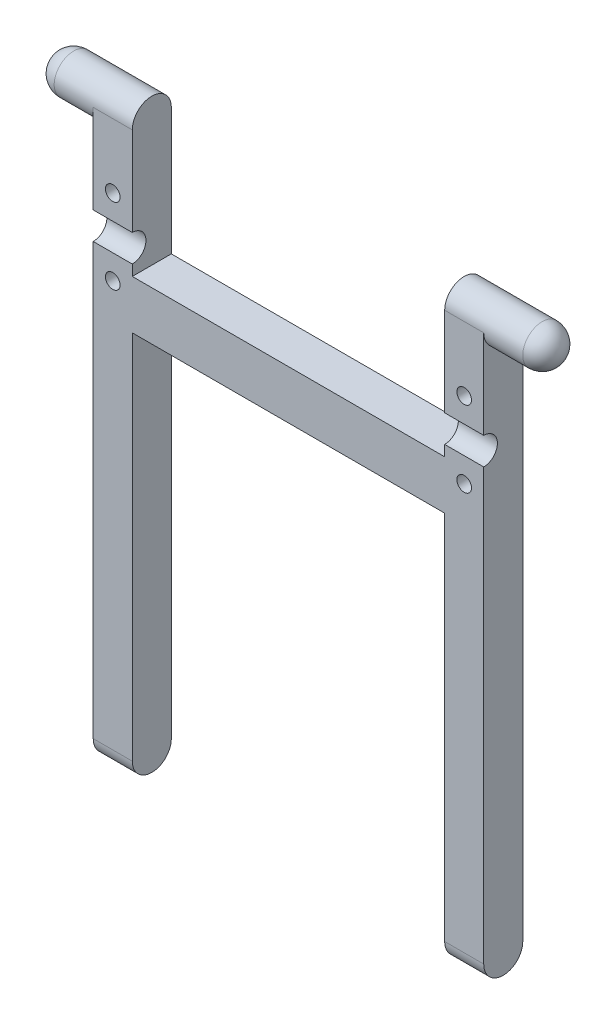
from build123d import *

# Parameters (mm, degrees)
SALIENTE_EXTRUIR1_DEPTH = 8
REDONDEO1_R             = 4
CROQUIS6_R              = 2.8
CORTAR_EXTRUIR1_DEPTH   = 80.000001
CROQUIS7_R              = 1.5
CORTAR_EXTRUIR2_DEPTH   = 8
CORTAR_EXTRUIR3_DEPTH   = 3


with BuildPart() as part:
    # Croquis1 → Saliente-Extruir1 (new body)
    with BuildSketch(Plane.XY):
        Polygon((-96.284761278, 9.613034623), (-96.284761278, -70.386965377), (-104.284761278, -70.386965377), (-104.284761278, 49.613034623), (-96.284761278, 49.613034623), (-96.284761278, 19.613034623), (-32.284761278, 19.613034623), (-32.284761278, 49.613034623), (-24.284761278, 49.613034623), (-24.284761278, -70.386965377), (-32.284761278, -70.386965377), (-32.284761278, 9.613034623), align=None)
    extrude(amount=SALIENTE_EXTRUIR1_DEPTH)

    # Redondeo1
    redondeo1_edges = [part.edges().sort_by_distance(p)[0] for p in [
        (-100.284761278, -70.386965377, 0),
        (-28.284761278, -70.386965377, 0),
        (-28.284761278, 49.613034623, 8),
        (-28.284761278, 49.613034623, 0),
        (-100.284761278, 49.613034623, 0),
        (-100.284761278, 49.613034623, 8),
        (-28.284761278, -70.386965377, 8),
        (-100.284761278, -70.386965377, 8),
    ]]
    fillet(redondeo1_edges, radius=REDONDEO1_R - 0.0001)  # a hair under: the kernel refuses the full size

    # Croquis4 → Revolución3 (revolve)
    with BuildSketch(Plane.XY.offset(4), mode=Mode.PRIVATE) as revoluci_n3_sk:
        with BuildLine():
            Line((-104.284761278, 49.613034623), (-112.284761278, 49.613034623))
            ThreePointArc((-112.284761278, 49.613034623), (-115.113188403, 48.441461748), (-116.284761278, 45.613034623))
            Line((-116.284761278, 45.613034623), (-104.284761278, 45.613034623))
            Line((-104.284761278, 45.613034623), (-104.284761278, 49.613034623))
        make_face()
    revoluci_n3 = revolve(revoluci_n3_sk.sketch.rotate(Axis((-104.284761278, 45.613034623, 4), (-1, 0, 0)), 90), axis=Axis((-104.284761278, 45.613034623, 4), (-1, 0, 0)))

    # Simetría1: Revolución3 across plane
    add(revoluci_n3.mirror(Plane.ZY.offset(64.284761278)))

    # Croquis6 → Cortar-Extruir1 (cut)
    with BuildSketch(Plane.ZY.offset(104.284761278)):
        with Locations((8, 24.613034623)):
            Circle(CROQUIS6_R)
    extrude(amount=-CORTAR_EXTRUIR1_DEPTH, mode=Mode.SUBTRACT)

    # Croquis7 → Cortar-Extruir2 (cut)
    with BuildSketch(Plane.XY.offset(8)):
        with Locations((-100.284761278, 16.813034623)):
            Circle(CROQUIS7_R)
        with Locations((-28.284761278, 16.813034623)):
            Circle(CROQUIS7_R)
        with Locations((-28.284761278, 32.413034623)):
            Circle(CROQUIS7_R)
        with Locations((-100.284761278, 32.413034623)):
            Circle(CROQUIS7_R)
    extrude(amount=-CORTAR_EXTRUIR2_DEPTH, mode=Mode.SUBTRACT)

    # Croquis8 → Cortar-Extruir3 (cut)
    with BuildSketch(Plane(origin=(0, 0, 0), x_dir=(-1, 0, 0), z_dir=(0, 0, -1))):
        Polygon((103.748862893, 16.813034623), (102.016812085, 19.813034623), (98.55271047, 19.813034623), (96.820659663, 16.813034623), (98.55271047, 13.813034623), (102.016812085, 13.813034623), align=None)
        Polygon((31.748862893, 16.813034623), (30.016812085, 19.813034623), (26.55271047, 19.813034623), (24.820659663, 16.813034623), (26.55271047, 13.813034623), (30.016812085, 13.813034623), align=None)
        Polygon((103.748862893, 32.413034623), (102.016812085, 35.413034623), (98.55271047, 35.413034623), (96.820659663, 32.413034623), (98.55271047, 29.413034623), (102.016812085, 29.413034623), align=None)
        Polygon((31.748862893, 32.413034623), (30.016812085, 35.413034623), (26.55271047, 35.413034623), (24.820659663, 32.413034623), (26.55271047, 29.413034623), (30.016812085, 29.413034623), align=None)
    extrude(amount=-CORTAR_EXTRUIR3_DEPTH, mode=Mode.SUBTRACT)


solid = part.part
